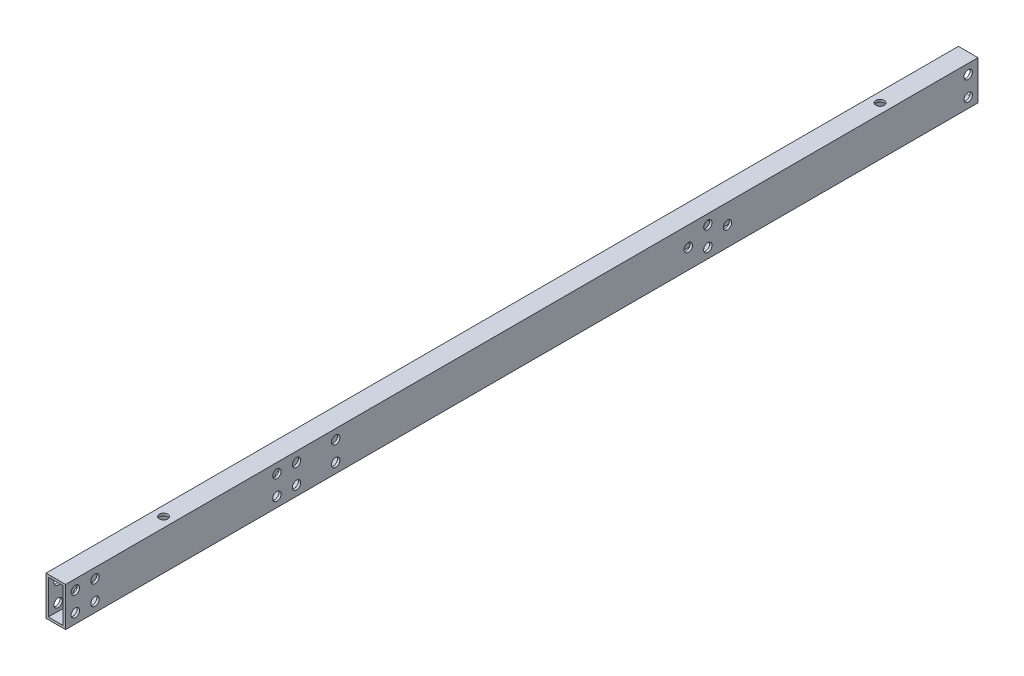
from build123d import *

# Parameters (mm, degrees)
SKETCH_1_W          = 10
SKETCH_1_H          = 20
SKETCH_1_W_2        = 7.6
SKETCH_1_H_2        = 17.6
EXTRUDE_1_DEPTH     = 465.8
SKETCH_2_R          = 2.15
CUT_EXTRUDE_1_DEPTH = 467.014634963
SKETCH_3_R          = 2.15
CUT_EXTRUDE_2_DEPTH = 467.255981195


with BuildPart() as part:
    # ｽｹｯﾁ1 → 押し出し-薄板1 (new body)
    with BuildSketch(Plane.XY):
        Rectangle(SKETCH_1_W, SKETCH_1_H)
        Rectangle(SKETCH_1_W_2, SKETCH_1_H_2, mode=Mode.SUBTRACT)
    extrude(amount=EXTRUDE_1_DEPTH)

    # ｽｹｯﾁ2 → ｶｯﾄ - 押し出し1 (cut, through all)
    with BuildSketch(Plane(origin=(5, 0, 0), x_dir=(0, 0, -1), z_dir=(1, 0, 0))):
        with Locations((-450.8, 5)):
            Circle(SKETCH_2_R)
        with Locations((-450.8, -5)):
            Circle(SKETCH_2_R)
        with Locations((-5, 5)):
            Circle(SKETCH_2_R)
        with Locations((-5, -5)):
            Circle(SKETCH_2_R)
        with Locations((-147.9, 0)):
            Circle(SKETCH_2_R)
        with Locations((-127.9, 0)):
            Circle(SKETCH_2_R)
        with Locations((-327.9, 5)):
            Circle(SKETCH_2_R)
        with Locations((-327.9, -5)):
            Circle(SKETCH_2_R)
        with Locations((-137.9, -5)):
            Circle(SKETCH_2_R)
        with Locations((-137.9, 5)):
            Circle(SKETCH_2_R)
        with Locations((-357.9, 5)):
            Circle(SKETCH_2_R)
        with Locations((-357.9, -5)):
            Circle(SKETCH_2_R)
        with Locations((-347.9, -5)):
            Circle(SKETCH_2_R)
        with Locations((-347.9, 5)):
            Circle(SKETCH_2_R)
        with Locations((-460.8, 5)):
            Circle(SKETCH_2_R)
        with Locations((-460.8, -5)):
            Circle(SKETCH_2_R)
    extrude(amount=-CUT_EXTRUDE_1_DEPTH, mode=Mode.SUBTRACT)

    # ｽｹｯﾁ3 → ｶｯﾄ - 押し出し2 (cut, through all)
    with BuildSketch(Plane(origin=(0, 10, 0), x_dir=(1, 0, 0), z_dir=(0, 1, 0))):
        with Locations((0, -410.8)):
            Circle(SKETCH_3_R)
        with Locations((0, -45)):
            Circle(SKETCH_3_R)
    extrude(amount=-CUT_EXTRUDE_2_DEPTH, mode=Mode.SUBTRACT)


solid = part.part
